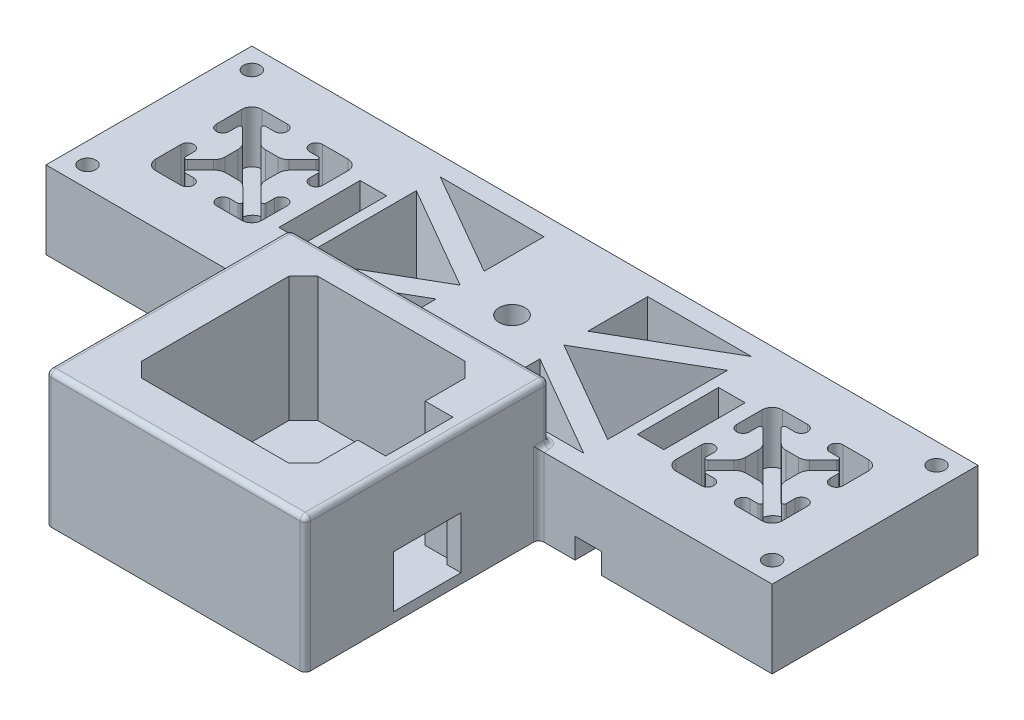
from build123d import *

# Parameters (mm, degrees)
SKETCH1_W               = 177.8
SKETCH1_H               = 50.4000008
BOSS_EXTRUDE1_DEPTH     = 6.35
SKETCH2_W               = 177.8
SKETCH2_H               = 50.4000008
BOSS_EXTRUDE2_DEPTH     = 12.7
SKETCH3_R               = 3.175
CUT_EXTRUDE1_DEPTH      = 186.784559586
CUT_EXTRUDE2_DEPTH      = 186.784559586
SKETCH5_W               = 6.5
SKETCH5_H               = 19.9
CUT_EXTRUDE3_DEPTH      = 10.2
SKETCH6_W               = 6.5
SKETCH6_H               = 4.572
CUT_EXTRUDE4_DEPTH      = 186.086574555
CUT_EXTRUDE5_DEPTH      = 186.241167349
CUT_EXTRUDE5_DEPTH_BACK = 186.241167349
SKETCH7_R               = 2.921
CUT_EXTRUDE6_DEPTH      = 186.241167349
CUT_EXTRUDE6_DEPTH_BACK = 186.241167349
SKETCH8_R               = 2.921
CHAMFER2_SIZE           = 3.302
CHAMFER3_SIZE           = 3.302
CUT_EXTRUDE8_DEPTH      = 5.08
BOSS_EXTRUDE4_DEPTH     = 33.02
CUT_EXTRUDE9_DEPTH      = 30.6
SKETCH13_W              = 16.5
SKETCH13_H              = 12.7
CUT_EXTRUDE10_DEPTH     = 30.6
FILLET1_R               = 1.27
SKETCH14_R              = 2.921
CUT_EXTRUDE11_DEPTH     = 190.249365917
SKETCH15_R              = 7.62
CUT_EXTRUDE12_DEPTH     = 8.128
SKETCH16_R              = 2.032
CUT_EXTRUDE13_DEPTH     = 188.728167838


with BuildPart() as part:
    # Sketch1 → Boss-Extrude1 (new body)
    with BuildSketch(Plane(origin=(0, 0, 0), x_dir=(1, 0, 0), z_dir=(0, 1, 0))):
        with Locations((88.9, 25.2000004)):
            Rectangle(SKETCH1_W, SKETCH1_H)
    extrude(amount=BOSS_EXTRUDE1_DEPTH)

    # Sketch2 → Boss-Extrude2 (add)
    with BuildSketch(Plane(origin=(0, 6.35, 0), x_dir=(1, 0, 0), z_dir=(0, 1, 0))):
        with Locations((88.9, 25.2000004)):
            Rectangle(SKETCH2_W, SKETCH2_H)
        with BuildLine():
            Line((38.207602115, 29.52001185), (38.207602115, 35.7371571))
            ThreePointArc((38.207602115, 35.7371571), (37.48390875, 37.484307436), (35.736758415, 38.2080008))
            Line((35.736758415, 38.2080008), (29.519613165, 38.2080008))
            ThreePointArc((29.519613165, 38.2080008), (27.941613165, 36.6300008), (29.519613165, 35.0520008))
            Line((29.519613165, 35.0520008), (31.618952135, 35.0520008))
            ThreePointArc((31.618952135, 35.0520008), (32.082805957, 34.741944038), (31.973665066, 34.194784253))
            Line((31.973665066, 34.194784253), (28.637609194, 30.863479703))
            ThreePointArc((28.637609194, 30.863479703), (27.774459736, 30.287408726), (26.756632806, 30.085138862))
            Line((26.756632806, 30.085138862), (23.642969309, 30.085138862))
            ThreePointArc((23.642969309, 30.085138862), (22.625142379, 30.287408726), (21.761992921, 30.863479703))
            Line((21.761992921, 30.863479703), (18.425937049, 34.194784253))
            ThreePointArc((18.425937049, 34.194784253), (18.316796158, 34.741944038), (18.78064998, 35.0520008))
            Line((18.78064998, 35.0520008), (20.87998895, 35.0520008))
            ThreePointArc((20.87998895, 35.0520008), (22.45798895, 36.6300008), (20.87998895, 38.2080008))
            Line((20.87998895, 38.2080008), (14.6628437, 38.2080008))
            ThreePointArc((14.6628437, 38.2080008), (12.915693364, 37.484307436), (12.192, 35.7371571))
            Line((12.192, 35.7371571), (12.192, 29.52001185))
            ThreePointArc((12.192, 29.52001185), (13.77, 27.94201185), (15.348, 29.52001185))
            Line((15.348, 29.52001185), (15.348, 31.596493464))
            ThreePointArc((15.348, 31.596493464), (15.657726258, 32.060210386), (16.204710632, 31.95171231))
            Line((16.204710632, 31.95171231), (19.406929995, 28.754053655))
            ThreePointArc((19.406929995, 28.754053655), (20.019806023, 27.837880259), (20.235040084, 26.756832148))
            Line((20.235040084, 26.756832148), (20.235040084, 23.643168652))
            ThreePointArc((20.235040084, 23.643168652), (20.019806023, 22.562120541), (19.406929995, 21.645947145))
            Line((19.406929995, 21.645947145), (16.204710632, 18.44828849))
            ThreePointArc((16.204710632, 18.44828849), (15.657726258, 18.339790414), (15.348, 18.803507336))
            Line((15.348, 18.803507336), (15.348, 20.87998895))
            ThreePointArc((15.348, 20.87998895), (13.77, 22.45798895), (12.192, 20.87998895))
            Line((12.192, 20.87998895), (12.192, 14.6628437))
            ThreePointArc((12.192, 14.6628437), (12.915693364, 12.915693364), (14.6628437, 12.192))
            Line((14.6628437, 12.192), (20.812064149, 12.192))
            ThreePointArc((20.812064149, 12.192), (22.390064149, 13.77), (20.812064149, 15.348))
            Line((20.812064149, 15.348), (18.78064998, 15.348))
            ThreePointArc((18.78064998, 15.348), (18.316796158, 15.658056762), (18.425937049, 16.205216547))
            Line((18.425937049, 16.205216547), (21.761992921, 19.536521097))
            ThreePointArc((21.761992921, 19.536521097), (22.625142379, 20.112592074), (23.642969309, 20.314861938))
            Line((23.642969309, 20.314861938), (26.756632806, 20.314861938))
            ThreePointArc((26.756632806, 20.314861938), (27.774459736, 20.112592074), (28.637609194, 19.536521097))
            Line((28.637609194, 19.536521097), (31.973665066, 16.205216547))
            ThreePointArc((31.973665066, 16.205216547), (32.082805957, 15.658056762), (31.618952135, 15.348))
            Line((31.618952135, 15.348), (29.587537966, 15.348))
            ThreePointArc((29.587537966, 15.348), (28.009537966, 13.77), (29.587537966, 12.192))
            Line((29.587537966, 12.192), (35.736758415, 12.192))
            ThreePointArc((35.736758415, 12.192), (37.48390875, 12.915693364), (38.207602115, 14.6628437))
            Line((38.207602115, 14.6628437), (38.207602115, 20.87998895))
            ThreePointArc((38.207602115, 20.87998895), (36.629602115, 22.45798895), (35.051602115, 20.87998895))
            Line((35.051602115, 20.87998895), (35.051602115, 18.803507336))
            ThreePointArc((35.051602115, 18.803507336), (34.741875857, 18.339790414), (34.194891482, 18.44828849))
            Line((34.194891482, 18.44828849), (30.99267212, 21.645947145))
            ThreePointArc((30.99267212, 21.645947145), (30.379796092, 22.562120541), (30.16456203, 23.643168652))
            Line((30.16456203, 23.643168652), (30.16456203, 26.756832148))
            ThreePointArc((30.16456203, 26.756832148), (30.379796092, 27.837880259), (30.99267212, 28.754053655))
            Line((30.99267212, 28.754053655), (34.194891482, 31.95171231))
            ThreePointArc((34.194891482, 31.95171231), (34.741875857, 32.060210386), (35.051602115, 31.596493464))
            Line((35.051602115, 31.596493464), (35.051602115, 29.52001185))
            ThreePointArc((35.051602115, 29.52001185), (36.629602115, 27.94201185), (38.207602115, 29.52001185))
        make_face(mode=Mode.SUBTRACT)
        with BuildLine():
            Line((142.748397885, 31.596493464), (142.748397885, 29.52001185))
            ThreePointArc((142.748397885, 29.52001185), (141.170397885, 27.94201185), (139.592397885, 29.52001185))
            Line((139.592397885, 29.52001185), (139.592397885, 35.7371571))
            ThreePointArc((139.592397885, 35.7371571), (140.31609125, 37.484307436), (142.063241585, 38.2080008))
            Line((142.063241585, 38.2080008), (148.280386835, 38.2080008))
            ThreePointArc((148.280386835, 38.2080008), (149.858386835, 36.6300008), (148.280386835, 35.0520008))
            Line((148.280386835, 35.0520008), (146.181047865, 35.0520008))
            ThreePointArc((146.181047865, 35.0520008), (145.717194043, 34.741944038), (145.826334934, 34.194784253))
            Line((145.826334934, 34.194784253), (149.162390806, 30.863479703))
            ThreePointArc((149.162390806, 30.863479703), (150.025540264, 30.287408726), (151.043367194, 30.085138862))
            Line((151.043367194, 30.085138862), (154.157030691, 30.085138862))
            ThreePointArc((154.157030691, 30.085138862), (155.174857621, 30.287408726), (156.038007079, 30.863479703))
            Line((156.038007079, 30.863479703), (159.374062951, 34.194784253))
            ThreePointArc((159.374062951, 34.194784253), (159.483203842, 34.741944038), (159.01935002, 35.0520008))
            Line((159.01935002, 35.0520008), (156.92001105, 35.0520008))
            ThreePointArc((156.92001105, 35.0520008), (155.34201105, 36.6300008), (156.92001105, 38.2080008))
            Line((156.92001105, 38.2080008), (163.1371563, 38.2080008))
            ThreePointArc((163.1371563, 38.2080008), (164.884306636, 37.484307436), (165.608, 35.7371571))
            Line((165.608, 35.7371571), (165.608, 29.52001185))
            ThreePointArc((165.608, 29.52001185), (164.03, 27.94201185), (162.452, 29.52001185))
            Line((162.452, 29.52001185), (162.452, 31.596493464))
            ThreePointArc((162.452, 31.596493464), (162.142273742, 32.060210386), (161.595289368, 31.95171231))
            Line((161.595289368, 31.95171231), (158.393070005, 28.754053655))
            ThreePointArc((158.393070005, 28.754053655), (157.780193977, 27.837880259), (157.564959916, 26.756832148))
            Line((157.564959916, 26.756832148), (157.564959916, 23.643168652))
            ThreePointArc((157.564959916, 23.643168652), (157.780193977, 22.562120541), (158.393070005, 21.645947145))
            Line((158.393070005, 21.645947145), (161.595289368, 18.44828849))
            ThreePointArc((161.595289368, 18.44828849), (162.142273742, 18.339790414), (162.452, 18.803507336))
            Line((162.452, 18.803507336), (162.452, 20.87998895))
            ThreePointArc((162.452, 20.87998895), (164.03, 22.45798895), (165.608, 20.87998895))
            Line((165.608, 20.87998895), (165.608, 14.6628437))
            ThreePointArc((165.608, 14.6628437), (164.884306636, 12.915693364), (163.1371563, 12.192))
            Line((163.1371563, 12.192), (156.987935851, 12.192))
            ThreePointArc((156.987935851, 12.192), (155.409935851, 13.77), (156.987935851, 15.348))
            Line((156.987935851, 15.348), (159.01935002, 15.348))
            ThreePointArc((159.01935002, 15.348), (159.483203842, 15.658056762), (159.374062951, 16.205216547))
            Line((159.374062951, 16.205216547), (156.038007079, 19.536521097))
            ThreePointArc((156.038007079, 19.536521097), (155.174857621, 20.112592074), (154.157030691, 20.314861938))
            Line((154.157030691, 20.314861938), (151.043367194, 20.314861938))
            ThreePointArc((151.043367194, 20.314861938), (150.025540264, 20.112592074), (149.162390806, 19.536521097))
            Line((149.162390806, 19.536521097), (145.826334934, 16.205216547))
            ThreePointArc((145.826334934, 16.205216547), (145.717194043, 15.658056762), (146.181047865, 15.348))
            Line((146.181047865, 15.348), (148.212462034, 15.348))
            ThreePointArc((148.212462034, 15.348), (149.790462034, 13.77), (148.212462034, 12.192))
            Line((148.212462034, 12.192), (142.063241585, 12.192))
            ThreePointArc((142.063241585, 12.192), (140.31609125, 12.915693364), (139.592397885, 14.6628437))
            Line((139.592397885, 14.6628437), (139.592397885, 20.87998895))
            ThreePointArc((139.592397885, 20.87998895), (141.170397885, 22.45798895), (142.748397885, 20.87998895))
            Line((142.748397885, 20.87998895), (142.748397885, 18.803507336))
            ThreePointArc((142.748397885, 18.803507336), (143.058124143, 18.339790414), (143.605108518, 18.44828849))
            Line((143.605108518, 18.44828849), (146.80732788, 21.645947145))
            ThreePointArc((146.80732788, 21.645947145), (147.420203908, 22.562120541), (147.63543797, 23.643168652))
            Line((147.63543797, 23.643168652), (147.63543797, 26.756832148))
            ThreePointArc((147.63543797, 26.756832148), (147.420203908, 27.837880259), (146.80732788, 28.754053655))
            Line((146.80732788, 28.754053655), (143.605108518, 31.95171231))
            ThreePointArc((143.605108518, 31.95171231), (143.058124143, 32.060210386), (142.748397885, 31.596493464))
        make_face(mode=Mode.SUBTRACT)
    extrude(amount=BOSS_EXTRUDE2_DEPTH)

    # Sketch3 → Cut-Extrude1 (cut, through all)
    with BuildSketch(Plane(origin=(0, 19.05, 0), x_dir=(1, 0, 0), z_dir=(0, 1, 0))):
        with Locations((88.9, 25.2000004)):
            Circle(SKETCH3_R)
    extrude(amount=-CUT_EXTRUDE1_DEPTH, mode=Mode.SUBTRACT)

    # Sketch4 → Cut-Extrude2 (cut, through all)
    with BuildSketch(Plane(origin=(0, 19.05, 0), x_dir=(1, 0, 0), z_dir=(0, 1, 0))):
        Polygon((50.8, 45.730575972), (76.2, 45.730575972), (76.2, 31.065879135), align=None)
        Polygon((76.2, 19.334121665), (76.2, 4.669424828), (50.8, 4.669424828), align=None)
        Polygon((50.8, 39.864697237), (50.8, 10.535303563), (76.2, 25.2000004), align=None)
        Polygon((101.6, 25.2000004), (127, 39.864697237), (127, 10.535303563), align=None)
        Polygon((127, 4.669424828), (101.6, 19.334121665), (101.6, 4.669424828), align=None)
        Polygon((101.6, 31.065879135), (127, 45.730575972), (101.6, 45.730575972), align=None)
    extrude(amount=-CUT_EXTRUDE2_DEPTH, mode=Mode.SUBTRACT)

    # Sketch5 → Cut-Extrude3 (cut)
    with BuildSketch(Plane(origin=(0, 19.05, 0), x_dir=(1, 0, 0), z_dir=(0, 1, 0))):
        with Locations((45.013602115, 25.2000004)):
            Rectangle(SKETCH5_W, SKETCH5_H)
    cut_extrude3 = extrude(amount=-CUT_EXTRUDE3_DEPTH, mode=Mode.SUBTRACT)

    # Sketch6 → Cut-Extrude4 (cut, through all)
    with BuildSketch(Plane(origin=(0, 8.85, 0), x_dir=(1, 0, 0), z_dir=(0, 1, 0))):
        with Locations((45.013602115, 32.8640004)):
            Rectangle(SKETCH6_W, SKETCH6_H)
        with Locations((45.013602115, 25.2000004)):
            Rectangle(SKETCH6_W, SKETCH6_H)
        with Locations((45.013602115, 17.5360004)):
            Rectangle(SKETCH6_W, SKETCH6_H)
    cut_extrude4 = extrude(amount=-CUT_EXTRUDE4_DEPTH, mode=Mode.SUBTRACT)

    # Mirror1: Cut-Extrude3, Cut-Extrude4 across plane
    add(cut_extrude3.mirror(Plane.ZY.offset(-88.9)), mode=Mode.SUBTRACT)
    add(cut_extrude4.mirror(Plane.ZY.offset(-88.9)), mode=Mode.SUBTRACT)

    # Sketch7 → Cut-Extrude5 (cut, two sides: drawn at the far end of the back side and taken through both)
    with BuildSketch(Plane(origin=(0, 6.35, 0), x_dir=(1, 0, 0), z_dir=(0, 1, 0)).offset(-CUT_EXTRUDE5_DEPTH_BACK)):
        with Locations((25.33856203, 25.259138862)):
            Circle(SKETCH7_R)
    extrude(amount=CUT_EXTRUDE5_DEPTH + CUT_EXTRUDE5_DEPTH_BACK, mode=Mode.SUBTRACT)

    # Sketch8 → Cut-Extrude6 (cut, two sides: drawn at the far end of the back side and taken through both)
    with BuildSketch(Plane(origin=(0, 6.35, 0), x_dir=(1, 0, 0), z_dir=(0, 1, 0)).offset(-CUT_EXTRUDE6_DEPTH_BACK)):
        with Locations((152.738959916, 25.259138862)):
            Circle(SKETCH8_R)
    extrude(amount=CUT_EXTRUDE6_DEPTH + CUT_EXTRUDE6_DEPTH_BACK, mode=Mode.SUBTRACT)

    # Chamfer2
    chamfer2_edges = [part.edges().sort_by_distance(p)[0] for p in [
        (149.817959916, 0, -25.259138862),
    ]]
    chamfer(chamfer2_edges, length=CHAMFER2_SIZE)

    # Chamfer3
    chamfer3_edges = [part.edges().sort_by_distance(p)[0] for p in [
        (22.41756203, 0, -25.259138862),
    ]]
    chamfer(chamfer3_edges, length=CHAMFER3_SIZE)

    # Sketch11 → Cut-Extrude8 (cut)
    with BuildSketch(Plane(origin=(0, 0, 0), x_dir=(1, 0, 0), z_dir=(0, 1, 0))):
        Polygon((41.763602115, 15.2500004), (41.763602115, 0), (48.263602115, 0), (48.263602115, 15.2500004), (48.263602115, 35.1500004), (48.263602115, 50.4000008), (41.763602115, 50.4000008), (41.763602115, 35.1500004), align=None)
        Polygon((136.036397885, 0), (129.536397885, 0), (129.536397885, 15.2500004), (129.536397885, 35.1500004), (129.536397885, 50.4000008), (136.036397885, 50.4000008), (136.036397885, 35.1500004), (136.036397885, 15.2500004), align=None)
    extrude(amount=CUT_EXTRUDE8_DEPTH, mode=Mode.SUBTRACT)

    # Sketch9 → Boss-Extrude4 (add)
    with BuildSketch(Plane(origin=(0, 0, 0), x_dir=(1, 0, 0), z_dir=(0, 1, 0))):
        Polygon((120.65, 0), (120.65, -57.15), (57.15, -57.15), (57.15, 0), (57.15, 2.54), (120.65, 2.54), align=None)
    extrude(amount=BOSS_EXTRUDE4_DEPTH)

    # Sketch12 → Cut-Extrude9 (cut)
    with BuildSketch(Plane(origin=(0, 33.02, 0), x_dir=(1, 0, 0), z_dir=(0, 1, 0))):
        Polygon((70.845533906, -4.3019996), (106.954466094, -4.3019996), (110.49, -7.837533506), (110.49, -17.6419996), (117.29, -17.6419996), (117.29, -34.1419996), (110.49, -34.1419996), (110.49, -43.946465694), (106.954466094, -47.4819996), (70.845533906, -47.4819996), (67.31, -43.946465694), (67.31, -7.837533506), align=None)
    extrude(amount=-CUT_EXTRUDE9_DEPTH, mode=Mode.SUBTRACT)

    # Sketch13 → Cut-Extrude10 (cut)
    with BuildSketch(Plane(origin=(120.65, 0, 0), x_dir=(0, 0, -1), z_dir=(1, 0, 0))):
        with Locations((-27.305, 8.77)):
            Rectangle(SKETCH13_W, SKETCH13_H)
    extrude(amount=-CUT_EXTRUDE10_DEPTH, mode=Mode.SUBTRACT)

    # Fillet1
    fillet1_edges = [part.edges().sort_by_distance(p)[0] for p in [
        (120.65, 19.05, -1.27),
        (57.15, 19.05, -1.27),
        (120.65, 26.035, -2.54),
        (57.15, 26.035, -2.54),
        (88.9, 19.05, -2.54),
        (57.15, 9.525, 0),
        (120.65, 9.525, 0),
        (120.65, 33.02, 27.305),
        (120.65, 16.51, 57.15),
        (88.9, 33.02, 57.15),
        (57.15, 33.02, 27.305),
        (57.15, 16.51, 57.15),
        (88.9, 33.02, -2.54),
    ]]
    fillet(fillet1_edges, radius=FILLET1_R)

    # Sketch14 → Cut-Extrude11 (cut, through all)
    with BuildSketch(Plane(origin=(0, 2.42, 0), x_dir=(1, 0, 0), z_dir=(0, 1, 0))):
        with Locations((88.9, -25.8919996)):
            Circle(SKETCH14_R)
    extrude(amount=-CUT_EXTRUDE11_DEPTH, mode=Mode.SUBTRACT)

    # Sketch15 → Cut-Extrude12 (cut)
    with BuildSketch(Plane(origin=(0, 0, 0), x_dir=(1, 0, 0), z_dir=(0, 1, 0))):
        with Locations((88.9, 25.2000004)):
            Circle(SKETCH15_R)
    extrude(amount=CUT_EXTRUDE12_DEPTH, mode=Mode.SUBTRACT)

    # Sketch16 → Cut-Extrude13 (cut, through all)
    with BuildSketch(Plane(origin=(0, 19.05, 0), x_dir=(1, 0, 0), z_dir=(0, 1, 0))):
        with Locations((5.08, 45.3200008)):
            Circle(SKETCH16_R)
        with Locations((5.08, 5.08)):
            Circle(SKETCH16_R)
        with Locations((172.72, 5.08)):
            Circle(SKETCH16_R)
        with Locations((172.72, 45.3200008)):
            Circle(SKETCH16_R)
    extrude(amount=-CUT_EXTRUDE13_DEPTH, mode=Mode.SUBTRACT)


solid = part.part
